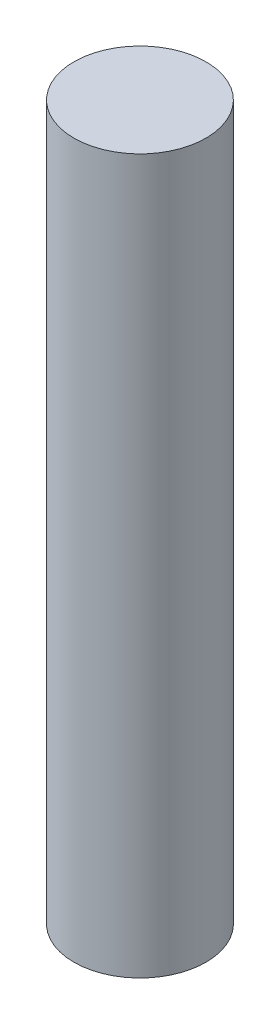
from build123d import *

# Parameters (mm, degrees)
SKETCH1_R           = 2.5
BOSS_EXTRUDE1_DEPTH = 13.5


with BuildPart() as part:
    # Sketch1 → Boss-Extrude1 (new, symmetric)
    with BuildSketch(Plane(origin=(0, 0, 0), x_dir=(1, 0, 0), z_dir=(0, 1, 0))):
        Circle(SKETCH1_R)
    extrude(amount=BOSS_EXTRUDE1_DEPTH, both=True)


solid = part.part
